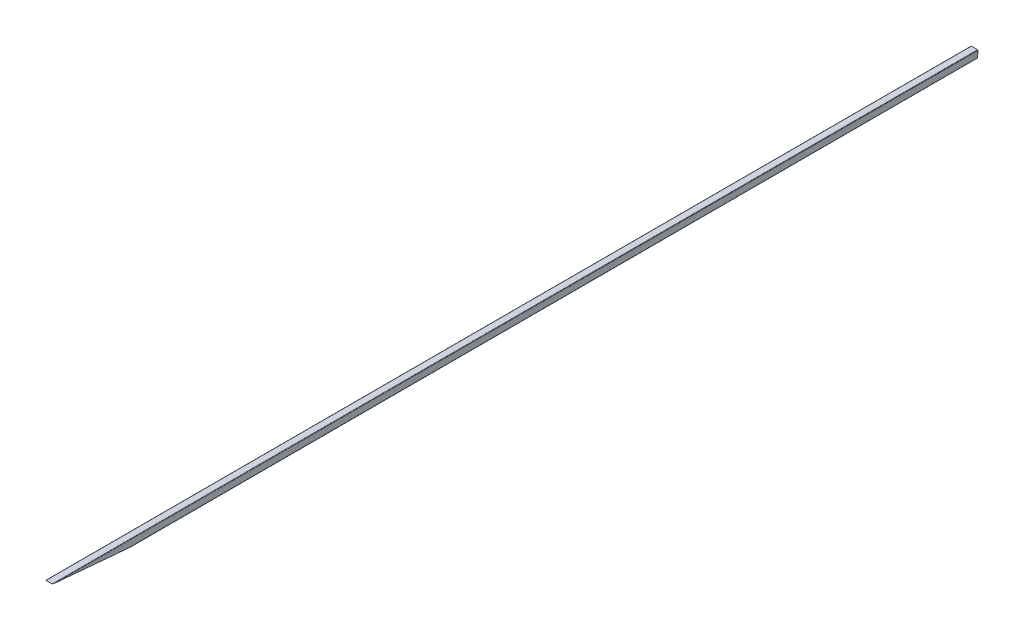
from build123d import *

# Parameters (mm, degrees)
BOSS_EXTRUDE1_DEPTH = 5000
CUT_EXTRUDE1_DEPTH  = 5001.290313572
CUT_EXTRUDE2_DEPTH  = 5001.290313572


with BuildPart() as part:
    # Sketch1 → Boss-Extrude1 (new body)
    with BuildSketch(Plane.XY):
        with BuildLine():
            Line((2.54, 0), (35.56, 0))
            ThreePointArc((35.56, 0), (37.356051224, -0.743948776), (38.1, -2.54))
            Line((38.1, -2.54), (38.1, -35.56))
            ThreePointArc((38.1, -35.56), (37.356051224, -37.356051224), (35.56, -38.1))
            Line((35.56, -38.1), (2.54, -38.1))
            ThreePointArc((2.54, -38.1), (0.743948776, -37.356051224), (0, -35.56))
            Line((0, -35.56), (0, -2.54))
            ThreePointArc((0, -2.54), (0.743948776, -0.743948776), (2.54, 0))
        make_face()
        with BuildLine():
            Line((5.3086, -2.7686), (32.7914, -2.7686))
            ThreePointArc((32.7914, -2.7686), (34.587451224, -3.512548776), (35.3314, -5.3086))
            Line((35.3314, -5.3086), (35.3314, -32.7914))
            ThreePointArc((35.3314, -32.7914), (34.587451224, -34.587451224), (32.7914, -35.3314))
            Line((32.7914, -35.3314), (5.3086, -35.3314))
            ThreePointArc((5.3086, -35.3314), (3.512548776, -34.587451224), (2.7686, -32.7914))
            Line((2.7686, -32.7914), (2.7686, -5.3086))
            ThreePointArc((2.7686, -5.3086), (3.512548776, -3.512548776), (5.3086, -2.7686))
        make_face(mode=Mode.SUBTRACT)
    extrude(amount=BOSS_EXTRUDE1_DEPTH)

    # Sketch2 → Cut-Extrude1 (cut, through all)
    with BuildSketch(Plane(origin=(38.1, 0, 0), x_dir=(0, 0, -1), z_dir=(1, 0, 0))):
        Polygon((-5000, 0), (-4564.515007265, -38.1), (-5000, -38.1), align=None)
    extrude(amount=-CUT_EXTRUDE1_DEPTH, mode=Mode.SUBTRACT)

    # Sketch4 → Cut-Extrude2 (cut, through all)
    with BuildSketch(Plane(origin=(38.1, 0, 0), x_dir=(0, 0, -1), z_dir=(1, 0, 0))):
        Polygon((0, 0), (-3.33331808, -38.1), (0, -38.1), align=None)
    extrude(amount=-CUT_EXTRUDE2_DEPTH, mode=Mode.SUBTRACT)


solid = part.part
